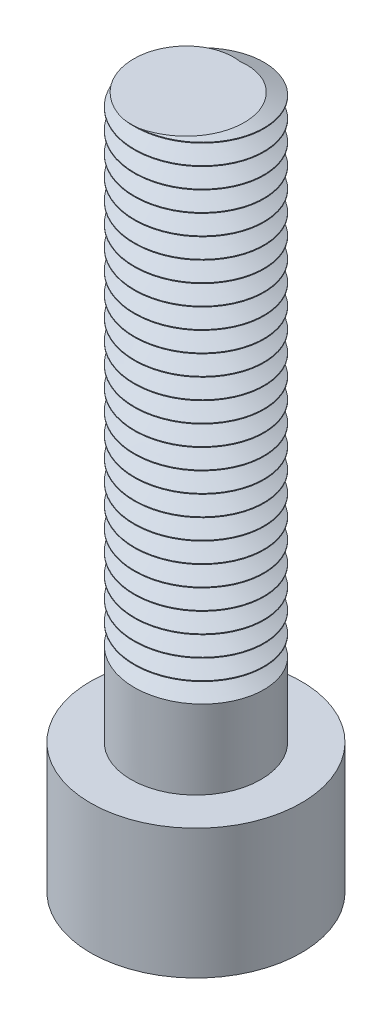
from build123d import *

# Parameters (mm, degrees)
SKETCH1_R           = 6.5
BOSS_EXTRUDE1_DEPTH = 8
SKETCH2_R           = 4
BOSS_EXTRUDE2_DEPTH = 35
CUT_SWEEP2_PITCH    = 1.25
CUT_EXTRUDE1_DEPTH  = 5.5
FILLET1_R           = 1


with BuildPart() as part:
    # Sketch1 → Boss-Extrude1 (new body)
    with BuildSketch(Plane(origin=(0, 0, 0), x_dir=(1, 0, 0), z_dir=(0, 1, 0))):
        with Locations(Location((0, 0, 0), (0, 0, 270))):
            Circle(SKETCH1_R)
    extrude(amount=BOSS_EXTRUDE1_DEPTH)

    # Sketch2 → Boss-Extrude2 (add)
    with BuildSketch(Plane(origin=(0, 8, 0), x_dir=(1, 0, 0), z_dir=(0, 1, 0))):
        with Locations(Location((0, 0, 0), (0, 0, 270))):
            Circle(SKETCH2_R)
    extrude(amount=BOSS_EXTRUDE2_DEPTH)

    # Cut-Sweep2: arcs per turn and ends read off the stored shape
    # Cut-Sweep2: the profile of Sketch4 screwed along a left-hand helix through 25 turns, 8 arcs to a turn; built about Z, then put on its axis
    cut_sweep2_z = Axis((0, 0, 0), (0, 0, 1))
    cut_sweep2_corners = [(4.003093029, -0.029716733, -1.847490368), (4.003093029, 0.029892689, -0.648971817), (2.703093029, 8.7978e-05, -1.248231093)]
    with BuildLine(mode=Mode.PRIVATE) as cut_sweep2_profile:
        Line(cut_sweep2_corners[0], cut_sweep2_corners[1])
        Line(cut_sweep2_corners[1], cut_sweep2_corners[2])
        Line(cut_sweep2_corners[2], cut_sweep2_corners[0])
    cut_sweep2_cap = Face(cut_sweep2_profile.wire())
    cut_sweep2_turn_angles = [0, -22.5, -45, -67.5, -90, -112.5, -135, -157.5, -180, -202.5, -225, -247.5, -270, -292.5, -315, -337.5, -360]
    cut_sweep2_turn_weights = [1, 0.9238795325112867, 1, 0.9238795325112867, 1, 0.9238795325112867, 1, 0.9238795325112867, 1, 0.9238795325112867, 1, 0.9238795325112867, 1, 0.9238795325112867, 1, 0.9238795325112867, 1]
    cut_sweep2_turn_rails = [Edge.make_bspline([Vector(p[0], p[1], 0).rotate(cut_sweep2_z, cut_sweep2_turn_angles[k]) / cut_sweep2_turn_weights[k] + Vector(0, 0, p[2] + -CUT_SWEEP2_PITCH * cut_sweep2_turn_angles[k] / 360) for k in range(17)], [0, 0, 0, 1, 1, 2, 2, 3, 3, 4, 4, 5, 5, 6, 6, 7, 7, 8, 8, 8], 2, cut_sweep2_turn_weights) for p in cut_sweep2_corners]
    cut_sweep2_turn_sides = [Face.make_surface_from_curves(cut_sweep2_turn_rails[p[0]], cut_sweep2_turn_rails[p[1]]) for p in [(0, 1), (1, 2), (2, 0)]]
    cut_sweep2 = Plane(origin=(0, 43, 0), x_dir=(0, 0, -1), z_dir=(0, -1, 0)) * Solid(Shell([*[p.moved(Location((0, 0, CUT_SWEEP2_PITCH * i))) for i in range(25) for p in cut_sweep2_turn_sides], cut_sweep2_cap, cut_sweep2_cap.rotate(cut_sweep2_z, -9000).moved(Location((0, 0, -CUT_SWEEP2_PITCH * -9000 / 360)))]))
    add(cut_sweep2, mode=Mode.SUBTRACT)

    # Sketch5 → Cut-Extrude1 (cut)
    with BuildSketch(Plane.XZ):
        Polygon((-3.464101615, 0), (-1.732050808, 3), (1.732050808, 3), (3.464101615, 0), (1.732050808, -3), (-1.732050808, -3), align=None)
    extrude(amount=-CUT_EXTRUDE1_DEPTH, mode=Mode.SUBTRACT)

    # Fillet1
    fillet1_edges = [part.edges().sort_by_distance(p)[0] for p in [
        (-2.598076211, 0, -1.5),
        (0, 0, -3),
        (2.598076211, 0, -1.5),
        (2.598076211, 0, 1.5),
        (0, 0, 3),
        (-2.598076211, 0, 1.5),
    ]]
    fillet(fillet1_edges, radius=FILLET1_R)


solid = part.part
